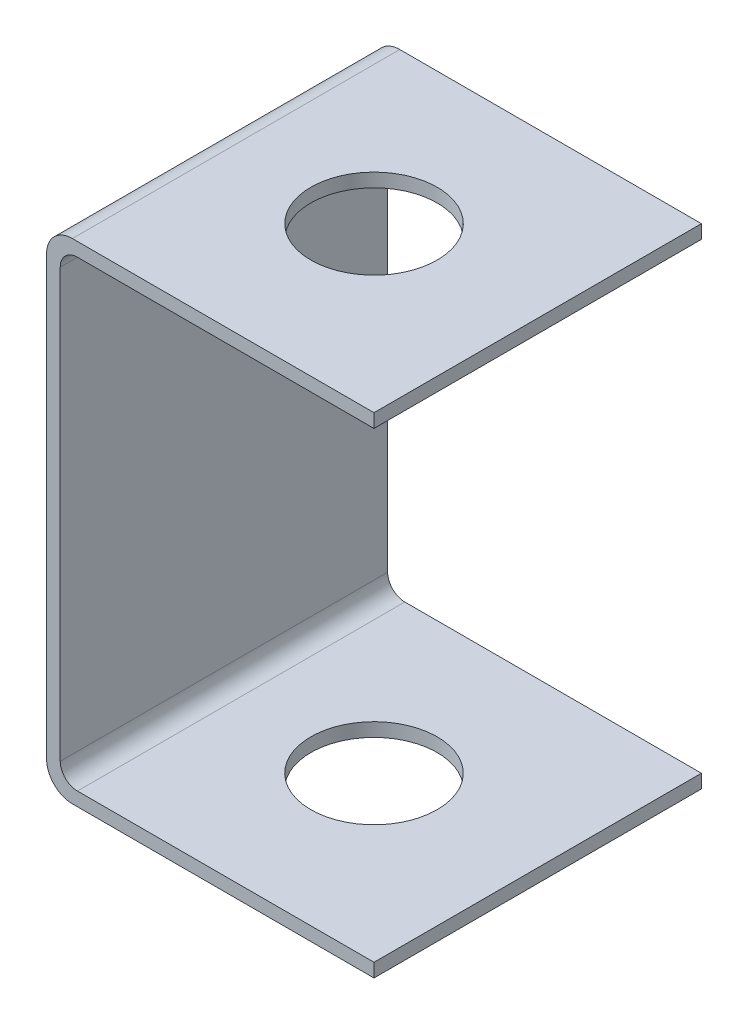
from build123d import *

# Parameters (mm, degrees)
BOSS_EXTRUDE1_DEPTH = 38.1
SKETCH3_R           = 7.35
CUT_EXTRUDE1_DEPTH  = 72.138337941
FILLET1_R           = 2
FILLET2_R           = 3


with BuildPart() as part:
    # Sketch1 → Boss-Extrude1 (new body)
    with BuildSketch(Plane.XY):
        Polygon((-17.4625, 55.3875), (19.05, 55.3875), (19.05, 56.975), (-19.05, 56.975), (-19.05, 0), (19.05, 0), (19.05, 1.5875), (-17.4625, 1.5875), align=None)
    extrude(amount=BOSS_EXTRUDE1_DEPTH)

    # Sketch3 → Cut-Extrude1 (cut, through all)
    with BuildSketch(Plane(origin=(0, 0, 0), x_dir=(1, 0, 0), z_dir=(0, 1, 0))):
        with Locations((0, -19.05)):
            Circle(SKETCH3_R)
    extrude(amount=CUT_EXTRUDE1_DEPTH, mode=Mode.SUBTRACT)

    # Fillet1
    fillet1_edges = [part.edges().sort_by_distance(p)[0] for p in [
        (-17.4625, 1.5875, 19.05),
        (-17.4625, 55.3875, 19.05),
    ]]
    fillet(fillet1_edges, radius=FILLET1_R)

    # Fillet2
    fillet2_edges = [part.edges().sort_by_distance(p)[0] for p in [
        (-19.05, 0, 19.05),
        (-19.05, 56.975, 19.05),
    ]]
    fillet(fillet2_edges, radius=FILLET2_R)


solid = part.part
